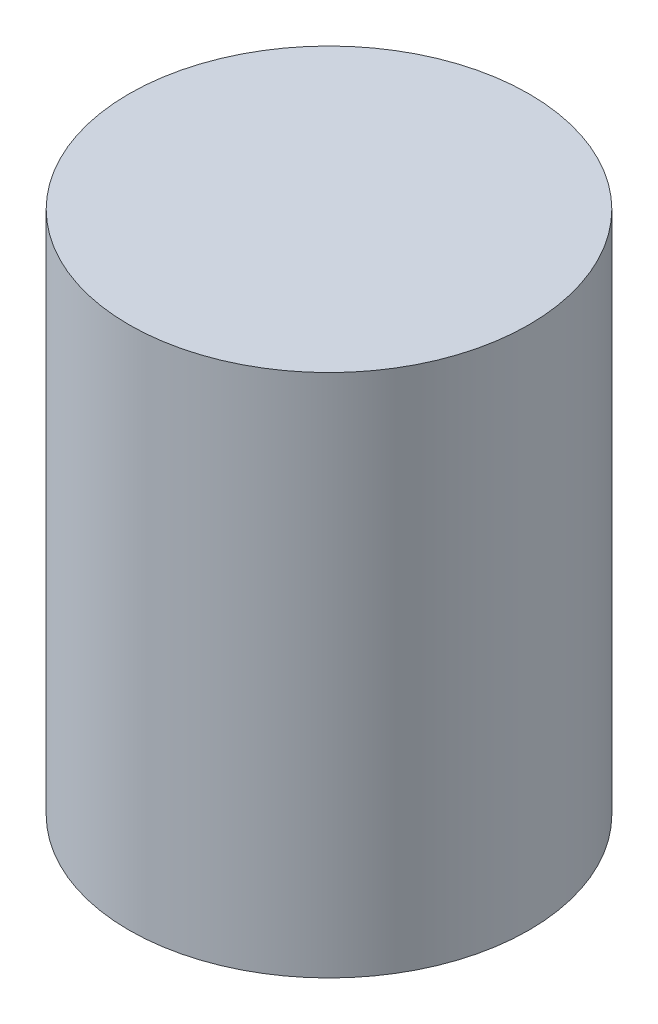
from build123d import *

# Parameters (mm, degrees)
SKETCH1_R           = 24.9
BOSS_EXTRUDE1_DEPTH = 65.278


with BuildPart() as part:
    # Sketch1 → Boss-Extrude1 (new body)
    with BuildSketch(Plane(origin=(0, 0, 0), x_dir=(1, 0, 0), z_dir=(0, 1, 0))):
        Circle(SKETCH1_R)
    extrude(amount=BOSS_EXTRUDE1_DEPTH)


solid = part.part
